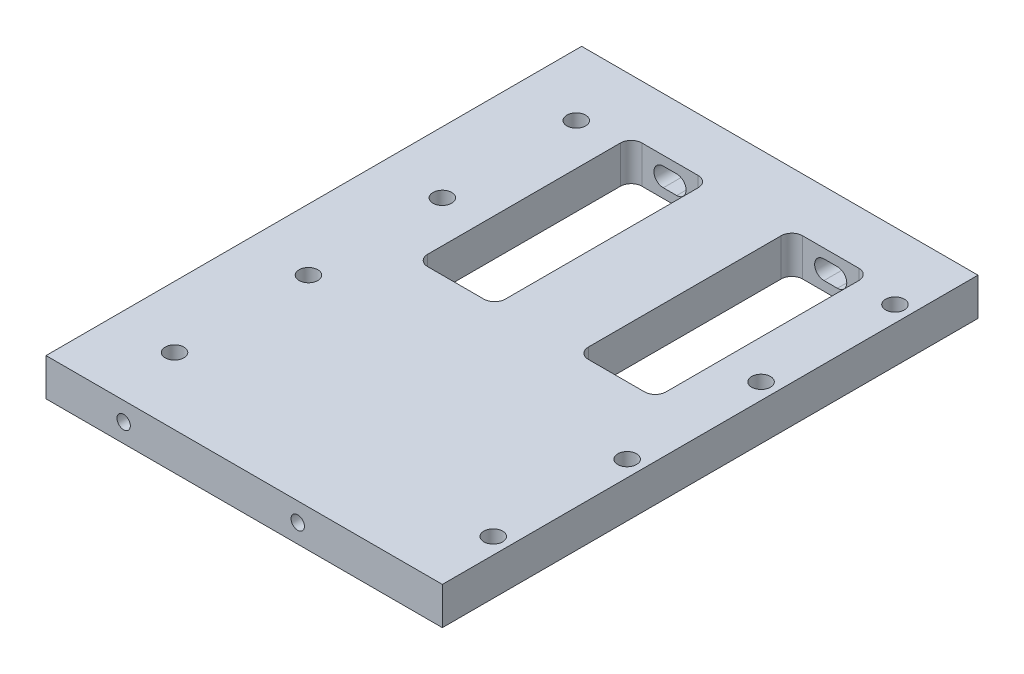
from build123d import *

# Parameters (mm, degrees)
BOSS_EXTRUDE1_DEPTH       = 200
CUT_EXTRUDE1_DEPTH        = 250.198715888
F_6_0MM_DOWEL_SLOT1_DEPTH = 20
M6X1_0_TAPPED_HOLE1_D     = 5
M6X1_0_TAPPED_HOLE1_DEPTH = 21.497848452
M6X1_0_TAPPED_HOLE1_TIP   = 1.502151548
FILLET1_R                 = 4
BOSS_EXTRUDE2_DEPTH       = 80
FILLET2_R                 = 4
SKETCH13_R                = 3.5
CUT_EXTRUDE2_DEPTH        = 250.198715888


# Read off the part's stored shape, not the designer's step: Ø6.0mm Dowel Slot1
with BuildPart() as part:
    # Sketch1 → Boss-Extrude1 (new body)
    with BuildSketch(Plane.XY):
        Polygon((-21, 207), (-148, 207), (-148, 197.5), (-148, 193), (-24, 193), (-12, 193), (0, 193), (0, 207), (-12, 207), align=None)
    extrude(amount=BOSS_EXTRUDE1_DEPTH)

    # Sketch3 → Cut-Extrude1 (cut, through all)
    with BuildSketch(Plane(origin=(0, 207, 0), x_dir=(1, 0, 0), z_dir=(0, 1, 0))):
        Polygon((-20.5, -100), (-20.5, -20), (-22.5, -20), (-27.5, -20), (-39.5, -20), (-42, -20), (-107.5, -20), (-109.5, -20), (-109.5, -100), (-107.5, -100), (-42, -100), (-39.5, -100), (-27.5, -100), (-22.5, -100), align=None)
    extrude(amount=-CUT_EXTRUDE1_DEPTH, mode=Mode.SUBTRACT)

    # Ø6.0mm Dowel Slot1 outline → Ø6.0mm Dowel Slot1 (cut)
    with BuildSketch(Plane.XY):
        with BuildLine():
            Line((-37.5, 196.5), (-32.5, 196.5))
            ThreePointArc((-32.5, 196.5), (-29, 200), (-32.5, 203.5))
            Line((-32.5, 203.5), (-37.5, 203.5))
            ThreePointArc((-37.5, 203.5), (-41, 200), (-37.5, 196.5))
        make_face()
        with BuildLine():
            ThreePointArc((-92.5, 196.5), (-89, 200), (-92.5, 203.5))
            Line((-92.5, 203.5), (-97.5, 203.5))
            ThreePointArc((-97.5, 203.5), (-101, 200), (-97.5, 196.5))
            Line((-97.5, 196.5), (-92.5, 196.5))
        make_face()
    extrude(amount=F_6_0MM_DOWEL_SLOT1_DEPTH, mode=Mode.SUBTRACT)

    # M6x1.0 Tapped Hole1
    with Locations(Plane.XY.offset(200)):
        with Locations((-119, 200), (-54, 200)):
            Hole(M6X1_0_TAPPED_HOLE1_D / 2, depth=M6X1_0_TAPPED_HOLE1_DEPTH)
            with Locations((0, 0, -(M6X1_0_TAPPED_HOLE1_DEPTH + M6X1_0_TAPPED_HOLE1_TIP / 2))):  # 118° drill point
                Cone(0, M6X1_0_TAPPED_HOLE1_D / 2, M6X1_0_TAPPED_HOLE1_TIP, mode=Mode.SUBTRACT)

    # Fillet1
    fillet1_edges = [part.edges().sort_by_distance(p)[0] for p in [
        (-20.5, 200, 100),
        (-109.5, 200, 100),
        (-109.5, 200, 20),
        (-20.5, 200, 20),
    ]]
    fillet(fillet1_edges, radius=FILLET1_R)

    # Sketch15 → Boss-Extrude2 (add)
    with BuildSketch(Plane.XY.offset(20)):
        Polygon((-80.5, 200), (-80.5, 193), (-49.5, 193), (-49.5, 200), (-49.5, 207), (-80.5, 207), align=None)
    extrude(amount=BOSS_EXTRUDE2_DEPTH)

    # Fillet2
    fillet2_edges = [part.edges().sort_by_distance(p)[0] for p in [
        (-80.5, 200, 20),
        (-49.5, 200, 20),
        (-80.5, 200, 100),
        (-49.5, 200, 100),
    ]]
    fillet(fillet2_edges, radius=FILLET2_R)

    # Sketch13 → Cut-Extrude2 (cut, through all)
    with BuildSketch(Plane.XZ.offset(-193)):
        with Locations(Location((-6, 75, 0), (0, 0, 270))):
            Circle(SKETCH13_R)
        with Locations(Location((-6, 125, 0), (0, 0, 270))):
            Circle(SKETCH13_R)
        with Locations(Location((-6, 175, 0), (0, 0, 270))):
            Circle(SKETCH13_R)
        with Locations(Location((-125, 125, 0), (0, 0, 270))):
            Circle(SKETCH13_R)
        with Locations(Location((-125, 75, 0), (0, 0, 270))):
            Circle(SKETCH13_R)
        with Locations(Location((-6, 25, 0), (0, 0, 270))):
            Circle(SKETCH13_R)
        with Locations(Location((-125, 175, 0), (0, 0, 270))):
            Circle(SKETCH13_R)
        with Locations(Location((-125, 25, 0), (0, 0, 270))):
            Circle(SKETCH13_R)
    extrude(amount=-CUT_EXTRUDE2_DEPTH, mode=Mode.SUBTRACT)


solid = part.part
